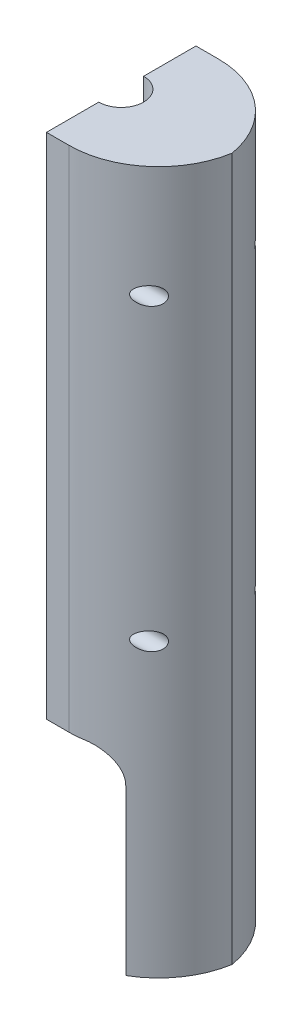
from build123d import *

# Parameters (mm, degrees)
BOSS_EXTRU_1_DEPTH            = 50
CONG_4_R                      = 35
CONG_5_R                      = 35
CONG_6_R                      = 30
CONG_12_R                     = 10
ENL_V_MAT_EXTRU_8_DEPTH       = 251
ESQUISSE6_R                   = 2
ENL_V_MAT_EXTRU_9_DEPTH       = 58
ENL_V_MAT_EXTRU_12_DEPTH      = 251.898527225
ENL_V_MAT_EXTRU_12_DEPTH_BACK = 179
ESQUISSE11_R                  = 3
ENL_V_MAT_EXTRU_14_DEPTH      = 20
BOSS_EXTRU_2_DEPTH            = 5
ESQUISSE13_W                  = 8
ESQUISSE13_H                  = 30
ESQUISSE13_W_2                = 30
ESQUISSE13_H_2                = 8
ENL_V_MAT_EXTRU_15_DEPTH      = 4


with BuildPart() as part:
    # Esquisse1 → Boss.-Extru.1 (new body)
    with BuildSketch(Plane.XY):
        Polygon((-129.391143911, 131.10701107), (-129.391143911, -98.89298893), (-124.391143911, -98.89298893), (-124.391143911, -33.89298893), (-64.391143911, -33.89298893), (-64.391143911, -98.89298893), (-49.391143911, -98.89298893), (-49.391143911, 131.10701107), align=None)
    extrude(amount=BOSS_EXTRU_1_DEPTH)

    # Congé4
    cong_4_edges = [part.edges().sort_by_distance(p)[0] for p in [
        (-129.391143911, 16.10701107, 50),
    ]]
    fillet(cong_4_edges, radius=CONG_4_R)

    # Congé5
    # the kernel refuses this fillet: 35 mm, written as the material it takes off along each edge
    with BuildSketch(Plane(origin=(-129.391143911, 202.914044152, 0), x_dir=(0, 0, 1), z_dir=(0, -1, 0))) as cong_5_piece_1:
        with BuildLine():
            CenterArc((35, -28.722813233), CONG_5_R, 124.849904579, 55.150095421)
            Line((0, -28.722813233), (-0.7, -28.722813233))
            Line((-0.7, -28.722813233), (-0.7, 0))
            Line((-0.7, 0), (0, 0.7))
            ThreePointArc((0, 0.7), (7.5, 0.7), (14.6, 0.574456265))
            Line((14.6, 0.574456265), (15, 0))
        make_face()
    extrude(amount=373.614066163, mode=Mode.SUBTRACT)

    # Congé6
    # the kernel refuses this fillet: 30 mm, written as the material it takes off along each edge
    with BuildSketch(Plane(origin=(-49.391143911, -173.89298893, 0), x_dir=(-1, 0, 0), z_dir=(0, 1, 0))) as cong_6_piece_1:
        with BuildLine():
            CenterArc((CONG_6_R, CONG_6_R), CONG_6_R, 180, 90)
            Line((0, CONG_6_R), (0, 0))
            Line((0, 0), (CONG_6_R, 0))
        make_face()
    extrude(amount=380, mode=Mode.SUBTRACT)
    with BuildSketch(Plane(origin=(-49.391143911, -173.89298893, 50), x_dir=(-1, 0, 0), z_dir=(0, 1, 0))) as cong_6_piece_2:
        with BuildLine():
            CenterArc((CONG_6_R, -CONG_6_R), CONG_6_R, 90, 90)
            Line((0, -CONG_6_R), (0, 0))
            Line((0, 0), (CONG_6_R, 0))
        make_face()
    extrude(amount=380, mode=Mode.SUBTRACT)

    # Congé12
    cong_12_edges = [part.edges().sort_by_distance(p)[0] for p in [
        (-124.391143911, -33.89298893, 21.146981396),
        (-64.391143911, -33.89298893, 25),
    ]]
    fillet(cong_12_edges, radius=CONG_12_R)

    # Esquisse5 → Enlèv. mat.-Extru.8 (cut)
    with BuildSketch(Plane(origin=(0, 131.10701107, 0), x_dir=(1, 0, 0), z_dir=(0, 1, 0))):
        with BuildLine():
            Line((-86.891143911, -50), (-86.891143911, 0))
            ThreePointArc((-86.891143911, 0), (-162.141280076, -25), (-86.891143911, -50))
        make_face()
    extrude(amount=-ENL_V_MAT_EXTRU_8_DEPTH, mode=Mode.SUBTRACT)

    # Esquisse6 → Enlèv. mat.-Extru.9 (cut)
    with BuildSketch(Plane.ZY.offset(86.891143911)):
        with Locations((7.5, 98.60701107)):
            Circle(ESQUISSE6_R)
        with Locations((42.5, 98.60701107)):
            Circle(ESQUISSE6_R)
        with Locations((42.5, -1.39298893)):
            Circle(ESQUISSE6_R)
        with Locations((7.5, -1.39298893)):
            Circle(ESQUISSE6_R)
    extrude(amount=-ENL_V_MAT_EXTRU_9_DEPTH, mode=Mode.SUBTRACT)

    # Esquisse9 → Enlèv. mat.-Extru.12 (cut, two sides: drawn at the far end of the back side and taken through both)
    with BuildSketch(Plane(origin=(0, 131.10701107, 0), x_dir=(1, 0, 0), z_dir=(0, 1, 0)).offset(-ENL_V_MAT_EXTRU_12_DEPTH_BACK)):
        with BuildLine():
            Line((-195.505666121, -17.5), (-86.891143911, -17.5))
            ThreePointArc((-86.891143911, -17.5), (-79.391143911, -25), (-86.891143911, -32.5))
            Line((-86.891143911, -32.5), (-195.505666121, -32.5))
            Line((-195.505666121, -32.5), (-412.73471054, -32.5))
            Line((-412.73471054, -32.5), (-412.73471054, -17.5))
            Line((-412.73471054, -17.5), (-195.505666121, -17.5))
        make_face()
    extrude(amount=ENL_V_MAT_EXTRU_12_DEPTH + ENL_V_MAT_EXTRU_12_DEPTH_BACK, mode=Mode.SUBTRACT)

    # Esquisse11 → Enlèv. mat.-Extru.14 (cut)
    with BuildSketch(Plane.ZY.offset(49.810744996)):
        with Locations(Location((42.5, 98.60701107, 0), (0, 0, 180))):
            Circle(ESQUISSE11_R)
        with Locations(Location((7.5, 98.60701107, 0), (0, 0, 180))):
            Circle(ESQUISSE11_R)
        with Locations(Location((42.5, -1.39298893, 0), (0, 0, 180))):
            Circle(ESQUISSE11_R)
        with Locations(Location((7.5, -1.39298893, 0), (0, 0, 180))):
            Circle(ESQUISSE11_R)
    extrude(amount=ENL_V_MAT_EXTRU_14_DEPTH, mode=Mode.SUBTRACT)

    # Esquisse12 → Boss.-Extru.2 (add)
    with BuildSketch(Plane(origin=(0, 131.10701107, 0), x_dir=(1, 0, 0), z_dir=(0, 1, 0))):
        with BuildLine():
            Line((-79.391143911, 0), (-86.891143911, 0))
            Line((-86.891143911, 0), (-86.891143911, -17.5))
            ThreePointArc((-86.891143911, -17.5), (-79.391143911, -25), (-86.891143911, -32.5))
            Line((-86.891143911, -32.5), (-86.891143911, -50))
            Line((-86.891143911, -50), (-79.391143911, -50))
            ThreePointArc((-79.391143911, -50), (-60.02622718, -42.912878475), (-49.810744996, -25))
            ThreePointArc((-49.810744996, -25), (-60.02622718, -7.087121525), (-79.391143911, 0))
        make_face()
    extrude(amount=BOSS_EXTRU_2_DEPTH)

    # Esquisse13 → Enlèv. mat.-Extru.15 (cut)
    with BuildSketch(Plane.ZY.offset(64.391143911)):
        with Locations((25, -71.39298893)):
            Rectangle(ESQUISSE13_W, ESQUISSE13_H)
        with Locations((25, -71.39298893)):
            Rectangle(ESQUISSE13_W_2, ESQUISSE13_H_2)
    extrude(amount=-ENL_V_MAT_EXTRU_15_DEPTH, mode=Mode.SUBTRACT)


solid = part.part
